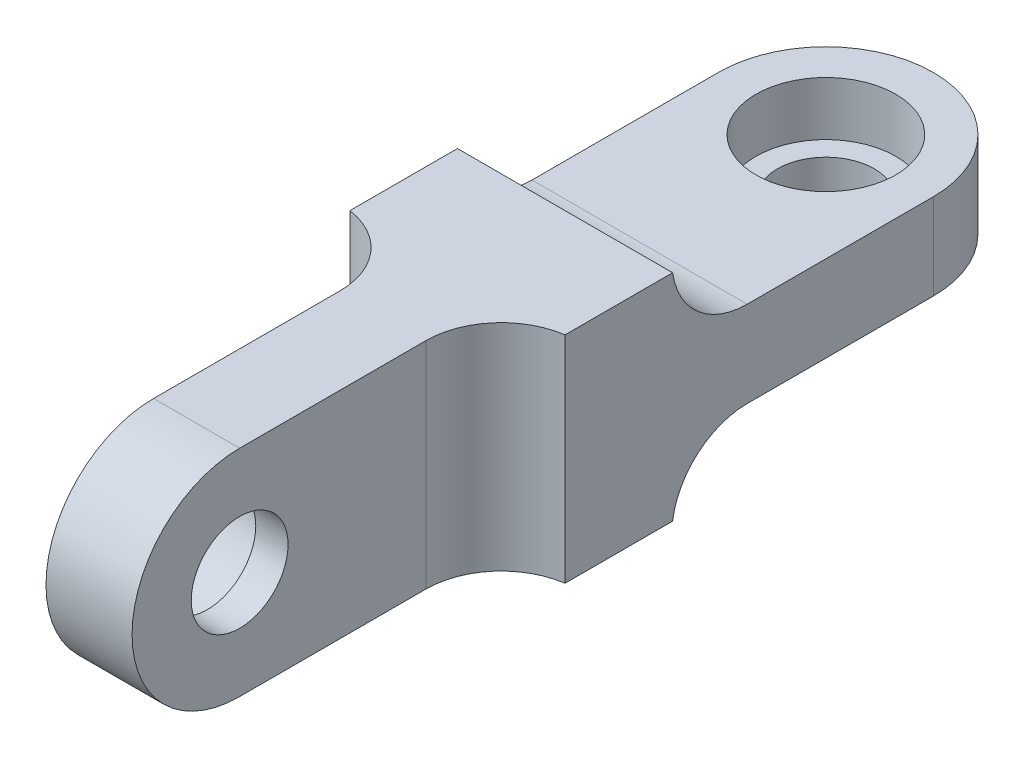
from build123d import *

# Parameters (mm, degrees)
SKETCH_1_W          = 20
SKETCH_1_H          = 20
EXTRUDE_1_DEPTH     = 80.297387422
SKETCH_7_W          = 35.148693711
SKETCH_7_H          = 6
CUT_EXTRUDE_6_DEPTH = 34
SKETCH_2_R          = 6.5
CUT_EXTRUDE_9_DEPTH = 5
SKETCH_3_R          = 4.5
CUT_EXTRUDE_2_DEPTH = 29
MOVE_BODY_1_ANGLE   = 90
SKETCH_8_W          = 20
SKETCH_8_H          = 20
EXTRUDE_2_DEPTH     = 8
FILLET_2_R          = 7


# Read off the part's stored shape, not the designer's step: 교차3
with BuildPart() as part:
    # 스케치1 → 보스-돌출1 (new body)
    with BuildSketch(Plane.XY):
        Rectangle(SKETCH_1_W, SKETCH_1_H)
    extrude(amount=EXTRUDE_1_DEPTH)

    # 스케치7 → 컷-돌출6 (cut)
    with BuildSketch(Plane(origin=(10, 0, 0), x_dir=(0, 0, -1), z_dir=(1, 0, 0))):
        with Locations((-17.574346855, 7)):
            Rectangle(SKETCH_7_W, SKETCH_7_H)
        with Locations((-17.574346855, -7)):
            Rectangle(SKETCH_7_W, SKETCH_7_H)
    cut_extrude_6 = extrude(amount=-CUT_EXTRUDE_6_DEPTH, mode=Mode.SUBTRACT)

    # 스케치2 → 컷-돌출9 (cut)
    with BuildSketch(Plane(origin=(0, 4, 0), x_dir=(-1, 0, 0), z_dir=(0, -1, 0))):
        with Locations(Location((0, -10.902706153, 0), (0, 0, 90))):
            Circle(SKETCH_2_R)
    cut_extrude_9 = extrude(amount=CUT_EXTRUDE_9_DEPTH, mode=Mode.SUBTRACT)

    # 스케치3 → 컷-돌출2 (cut)
    with BuildSketch(Plane(origin=(0, -4, 0), x_dir=(-1, 0, 0), z_dir=(0, -1, 0))):
        with Locations(Location((0, -10.902706153, 0), (0, 0, 90))):
            Circle(SKETCH_3_R)
        with BuildLine():
            Line((-21.262122506, -10.902706153), (-10, -10.902706153))
            ThreePointArc((-10, -10.902706153), (0, -0.902706153), (10, -10.902706153))
            Line((10, -10.902706153), (21.262122506, -10.902706153))
            ThreePointArc((21.262122506, -10.902706153), (0, 10.359416353), (-21.262122506, -10.902706153))
        make_face()
    cut_extrude_2 = extrude(amount=-CUT_EXTRUDE_2_DEPTH, mode=Mode.SUBTRACT)

    # 대칭 복사6: 컷-돌출6, 컷-돌출9, 컷-돌출2 across plane
    add(cut_extrude_6.mirror(Plane.XY.offset(40.148693711)), mode=Mode.SUBTRACT)
    add(cut_extrude_9.mirror(Plane.XY.offset(40.148693711)), mode=Mode.SUBTRACT)
    add(cut_extrude_2.mirror(Plane.XY.offset(40.148693711)), mode=Mode.SUBTRACT)


with BuildPart() as body_2:
    # 교차3: the piece on the far side of the plane
    add(part.part)
    split(bisect_by=Plane.XY.offset(40.148693711), keep=Keep.BOTTOM)


with BuildPart() as part_1:
    add(part.part)

    # 교차3
    split(bisect_by=Plane.XY.offset(40.148693711), keep=Keep.TOP)


with BuildPart() as part_2:
    # Move Body 1: moved
    add(part_1.part.rotate(Axis((0, 0, 0), (0, 0, 1)), MOVE_BODY_1_ANGLE))


    add(body_2.part)  # 보스-돌출2 merges body 2
    # 스케치8 → 보스-돌출2 (add)
    with BuildSketch(Plane.XY.offset(45.148693711)):
        Rectangle(SKETCH_8_W, SKETCH_8_H)
    extrude(amount=-EXTRUDE_2_DEPTH)

    # 필렛2
    # the kernel refuses this fillet: 7 mm, written as the material it adds along each edge
    with BuildSketch(Plane(origin=(-4, 10, 45.148693711), x_dir=(0, 0, 1), z_dir=(0, -1, 0)), Plane(origin=(10, -4, 35.148693711), x_dir=(0, 0, -1), z_dir=(-1, 0, 0))) as fillet_2_piece_1:
        with BuildLine():
            CenterArc((6.92820323, 7), FILLET_2_R, 188.213210702, 81.786789298)
            Line((0, 6), (-0.138564065, 5.98))
            ThreePointArc((-0.138564065, 5.98), (-0.14, 3), (-0.14, 0))
            Line((-0.14, 0), (0, -0.14))
            Line((0, -0.14), (6.92820323, -0.14))
            Line((6.92820323, -0.14), (6.92820323, 0))
        make_face()
    extrude(amount=20)
    with BuildSketch(Plane(origin=(4, 10, 45.148693711), x_dir=(1, 0, 0), z_dir=(0, -1, 0))) as fillet_2_piece_2:
        with BuildLine():
            CenterArc((7, 6.92820323), FILLET_2_R, 180, 81.786789298)
            Line((0, 6.92820323), (-0.14, 6.92820323))
            Line((-0.14, 6.92820323), (-0.14, 0))
            Line((-0.14, 0), (0, -0.14))
            ThreePointArc((0, -0.14), (3, -0.14), (5.98, -0.138564065))
            Line((5.98, -0.138564065), (6, 0))
        make_face()
    extrude(amount=20)
    with BuildSketch(Plane(origin=(10, 4, 35.148693711), x_dir=(0, 0, -1), z_dir=(-1, 0, 0))) as fillet_2_piece_3:
        with BuildLine():
            CenterArc((6.92820323, -7), FILLET_2_R, 90, 81.786789298)
            Line((0, -6), (-0.138564065, -5.98))
            ThreePointArc((-0.138564065, -5.98), (-0.14, -3), (-0.14, 0))
            Line((-0.14, 0), (0, 0.14))
            Line((0, 0.14), (6.92820323, 0.14))
            Line((6.92820323, 0.14), (6.92820323, 0))
        make_face()
    extrude(amount=20)


solid = part_2.part
